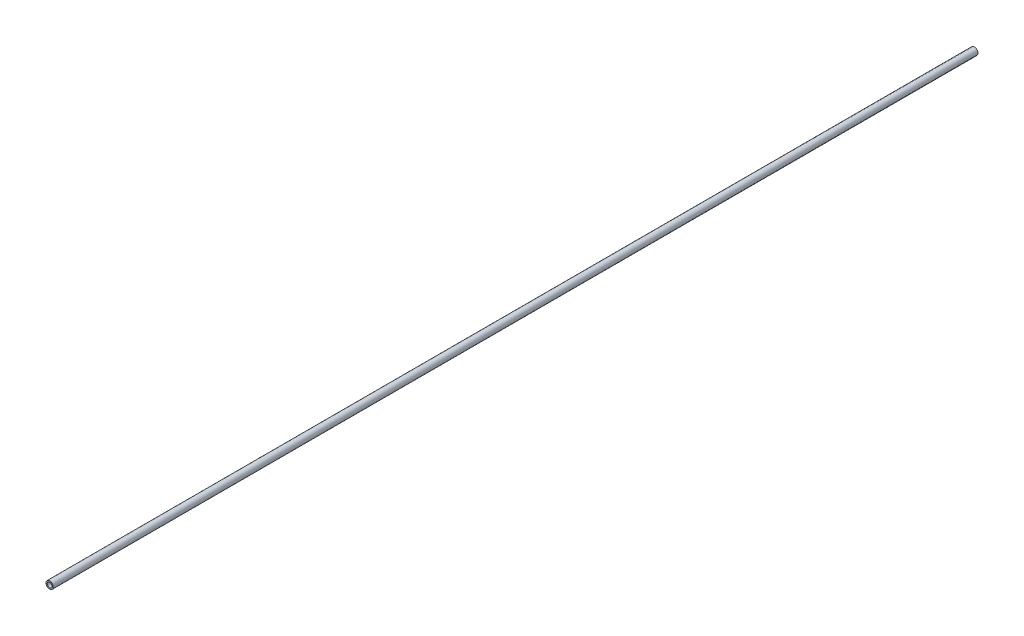
from build123d import *

# Parameters (mm, degrees)
SKETCH1_R           = 4.7625
SKETCH1_R_2         = 3.175
BOSS_EXTRUDE1_DEPTH = 1219.2


with BuildPart() as part:
    # Sketch1 → Boss-Extrude1 (new body)
    with BuildSketch(Plane.XY):
        Circle(SKETCH1_R)
        Circle(SKETCH1_R_2, mode=Mode.SUBTRACT)
    extrude(amount=BOSS_EXTRUDE1_DEPTH)


solid = part.part
